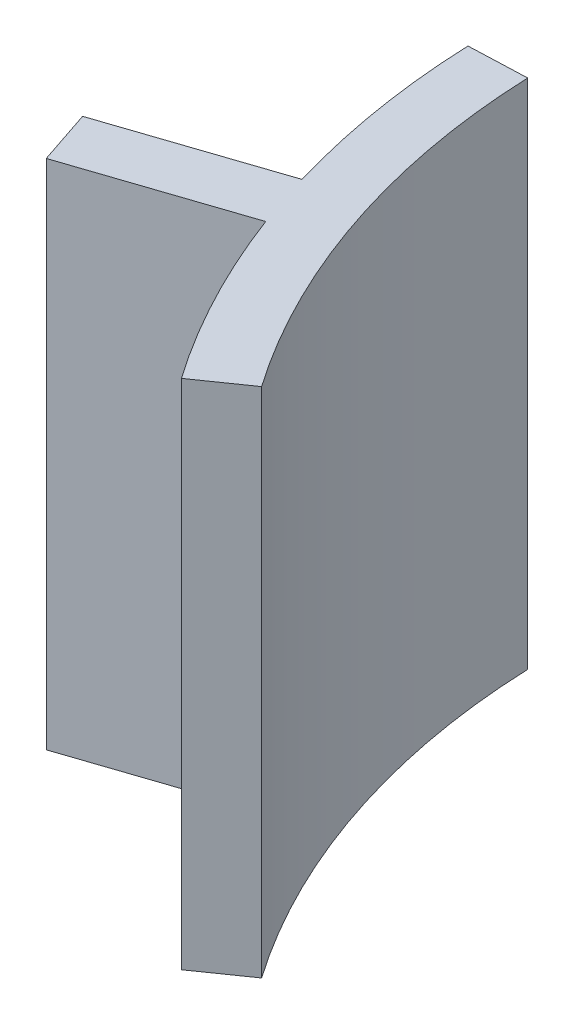
from build123d import *

# Parameters (mm, degrees)
BOSS_EXTRUDE1_DEPTH = 80


with BuildPart() as part:
    # Sketch1 → Boss-Extrude1 (new body)
    with BuildSketch(Plane(origin=(0, 0, 0), x_dir=(1, 0, 0), z_dir=(0, 1, 0))):
        with BuildLine():
            ThreePointArc((-95.954239713, -66.946126708), (-110.932453327, -37.188584253), (-116.916635621, -4.415916094))
            Line((-116.916635621, -4.415916094), (-125.910222977, -4.755601947))
            ThreePointArc((-125.910222977, -4.755601947), (-124.33504334, -20.415606716), (-120.819834949, -35.757062))
            Line((-120.819834949, -35.757062), (-146.495846053, -44.364592742))
            Line((-146.495846053, -44.364592742), (-143.635185726, -52.897858382))
            Line((-143.635185726, -52.897858382), (-117.959174622, -44.290327641))
            ThreePointArc((-117.959174622, -44.290327641), (-111.517269867, -58.65064809), (-103.335335075, -72.095828762))
            Line((-103.335335075, -72.095828762), (-95.954239713, -66.946126708))
        make_face()
    extrude(amount=BOSS_EXTRUDE1_DEPTH)


solid = part.part
